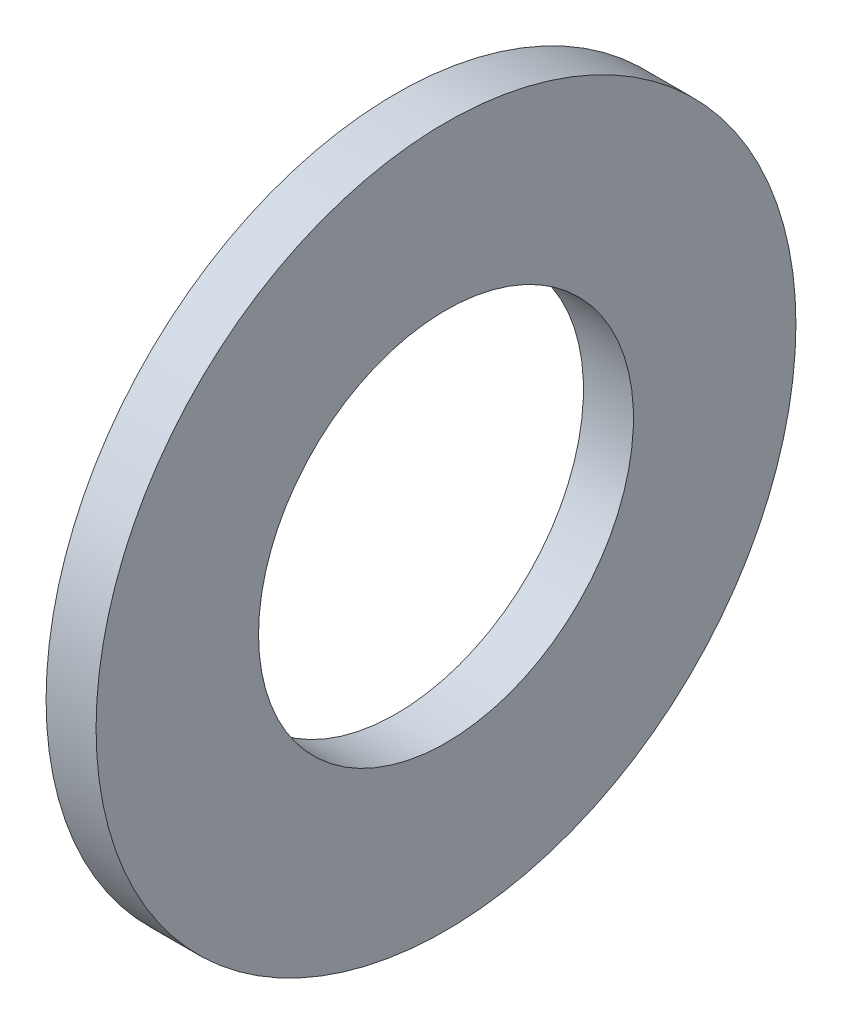
from build123d import *

# Parameters (mm, degrees)
SKETCH3_W = 2.000000064
SKETCH3_H = 6.499999954


with BuildPart() as part:
    # Sketch3 → Revolve1 (revolve)
    with BuildSketch(Plane.XY):
        with Locations((3.999999874, 10.749999963)):
            Rectangle(SKETCH3_W, SKETCH3_H)
    revolve(axis=Axis((0, 0, 0), (1, 0, 0)))


solid = part.part
